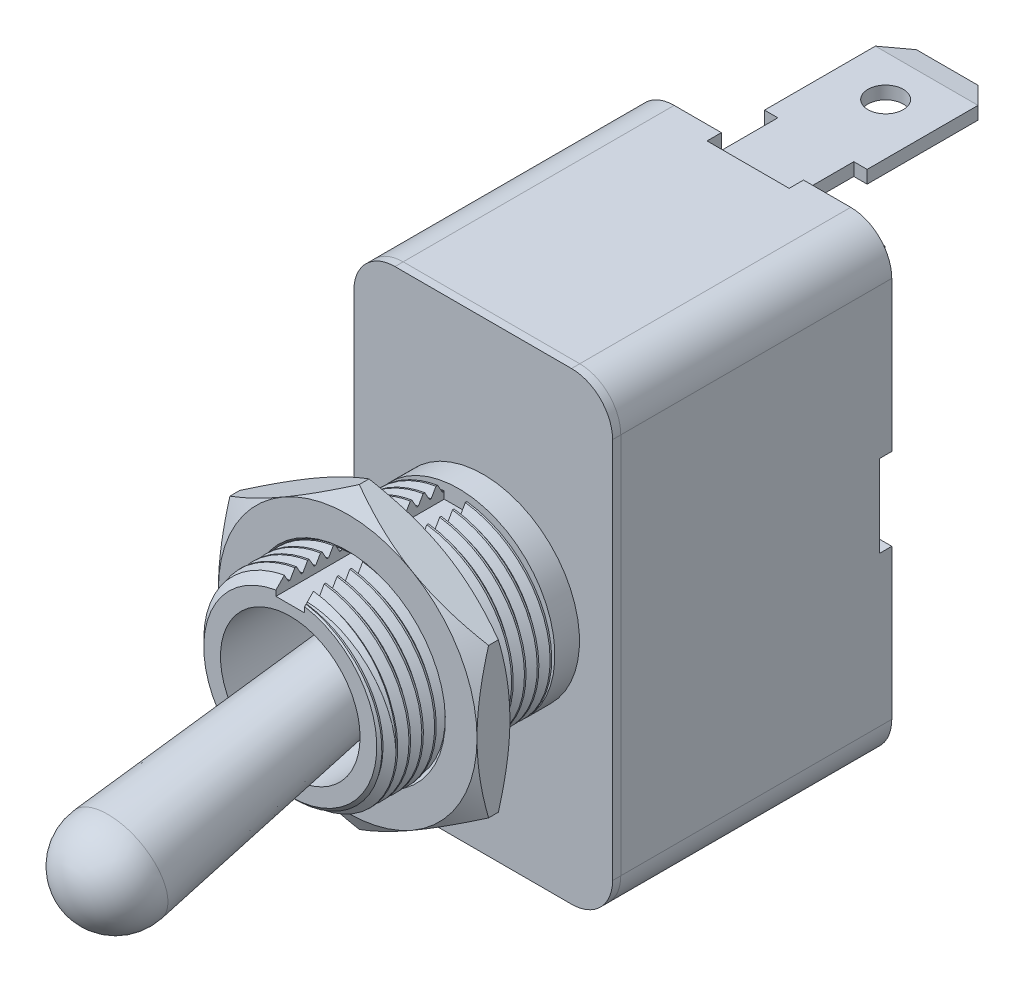
from build123d import *
from OCP.BRepFilletAPI import BRepFilletAPI_MakeChamfer

# Parameters (mm, degrees)
SKETCH4_R             = 5.953125
BOSS_EXTRUDE1_DEPTH   = 10.414
CUT_SWEEP1_PITCH      = 0.79375
SKETCH7_OUTSIDE_W     = 38.694
SKETCH7_OUTSIDE_H     = 38.694
SKETCH7_OUTSIDE_R     = 5.351643294
CUT_EXTRUDE1_DEPTH    = 10.414
CUT_EXTRUDE1_DRAFT    = -45
SKETCH8_R             = 5.953125
BOSS_EXTRUDE2_DEPTH   = 1.524
BOSS_EXTRUDE3_DEPTH   = 0.508
SKETCH10_R            = 4.318
CUT_EXTRUDE2_DEPTH    = 11.938
CUT_EXTRUDE3_DEPTH    = 10.414
BOSS_EXTRUDE4_DEPTH   = 16.764
SKETCH14_W            = 8.382
SKETCH14_H            = 5.08
CUT_EXTRUDE4_DEPTH    = 0.889
SKETCH15_W            = 5.08
SKETCH15_H            = 16.002
CUT_EXTRUDE5_DEPTH    = 0.762
SKETCH16_W            = 6.35
SKETCH16_H            = 4.699
BOSS_EXTRUDE5_DEPTH   = 0.79375
SKETCH17_R            = 1.0922
BOSS_EXTRUDE6_DEPTH   = 0.79375
CHAMFER1_SIZE         = 1.27
CHAMFER2_SIZE         = 1.27
CHAMFER2_SIZE2        = 0.1905
SKETCH18_W            = 4.699
SKETCH18_H            = 6.35
BOSS_EXTRUDE7_DEPTH   = 0.79375
SKETCH19_R            = 1.0922
BOSS_EXTRUDE8_DEPTH   = 0.79375
CHAMFER3_SIZE         = 1.27
CHAMFER4_SIZE         = 0.1905
CHAMFER4_SIZE2        = 1.27
BOSS_EXTRUDE9_START   = -5.585
SKETCH20_R            = 5.437569252
BOSS_EXTRUDE9_DEPTH   = 2.032
BODY_MOVE_COPY1_ANGLE = 120
BODY_MOVE_COPY2_ANGLE = 11.5


with BuildPart() as part:
    # Sketch4 → Boss-Extrude1 (new body)
    with BuildSketch(Plane(origin=(0, 11.938, 0), x_dir=(-1, 0, 0), z_dir=(0, 1, 0))):
        with Locations(Location((0, 0, 0), (0, 0, 90))):
            Circle(SKETCH4_R)
    extrude(amount=-BOSS_EXTRUDE1_DEPTH)

    # Cut-Sweep1: arcs per turn and ends read off the stored shape
    # Cut-Sweep1: the profile of Sketch6 screwed along a right-hand helix through 15.12 turns, 8 arcs to a turn; built about Z, then put on its axis
    cut_sweep1_z = Axis((0, 0, 0), (0, 0, 1))
    cut_sweep1_corners = [(5.437569252, 0, -1.190625), (5.437569252, 0, -1.09140625), (5.996087979, 0, -0.768945313), (5.996087979, 0, -1.513085938)]
    with BuildLine(mode=Mode.PRIVATE) as cut_sweep1_profile:
        Line(cut_sweep1_corners[0], cut_sweep1_corners[1])
        Line(cut_sweep1_corners[1], cut_sweep1_corners[2])
        Line(cut_sweep1_corners[2], cut_sweep1_corners[3])
        Line(cut_sweep1_corners[3], cut_sweep1_corners[0])
    cut_sweep1_cap = Face(cut_sweep1_profile.wire())
    cut_sweep1_turn_angles = [0, 22.5, 45, 67.5, 90, 112.5, 135, 157.5, 180, 202.5, 225, 247.5, 270, 292.5, 315, 337.5, 360]
    cut_sweep1_turn_weights = [1, 0.9238795325112867, 1, 0.9238795325112867, 1, 0.9238795325112867, 1, 0.9238795325112867, 1, 0.9238795325112867, 1, 0.9238795325112867, 1, 0.9238795325112867, 1, 0.9238795325112867, 1]
    cut_sweep1_turn_rails = [Edge.make_bspline([Vector(p[0], p[1], 0).rotate(cut_sweep1_z, cut_sweep1_turn_angles[k]) / cut_sweep1_turn_weights[k] + Vector(0, 0, p[2] + CUT_SWEEP1_PITCH * cut_sweep1_turn_angles[k] / 360) for k in range(17)], [0, 0, 0, 1, 1, 2, 2, 3, 3, 4, 4, 5, 5, 6, 6, 7, 7, 8, 8, 8], 2, cut_sweep1_turn_weights) for p in cut_sweep1_corners]
    cut_sweep1_turn_sides = [Face.make_surface_from_curves(cut_sweep1_turn_rails[p[0]], cut_sweep1_turn_rails[p[1]]) for p in [(0, 1), (1, 2), (2, 3), (3, 0)]]
    cut_sweep1_last_angles = [5400, 5421.6, 5443.2]
    cut_sweep1_last_weights = [1, 0.929776485888252, 1]
    cut_sweep1_last_rails = [Edge.make_bspline([Vector(p[0], p[1], 0).rotate(cut_sweep1_z, cut_sweep1_last_angles[k]) / cut_sweep1_last_weights[k] + Vector(0, 0, p[2] + CUT_SWEEP1_PITCH * cut_sweep1_last_angles[k] / 360) for k in range(3)], [0, 0, 0, 1, 1, 1], 2, cut_sweep1_last_weights) for p in cut_sweep1_corners]
    cut_sweep1_last_sides = [Face.make_surface_from_curves(cut_sweep1_last_rails[p[0]], cut_sweep1_last_rails[p[1]]) for p in [(0, 1), (1, 2), (2, 3), (3, 0)]]
    cut_sweep1 = Plane(origin=(0, 11.938, 0), x_dir=(-1, 0, 0), z_dir=(0, -1, 0)) * Solid(Shell([*[p.moved(Location((0, 0, CUT_SWEEP1_PITCH * i))) for i in range(15) for p in cut_sweep1_turn_sides], *cut_sweep1_last_sides, cut_sweep1_cap, cut_sweep1_cap.rotate(cut_sweep1_z, 5443.2).moved(Location((0, 0, CUT_SWEEP1_PITCH * 5443.2 / 360)))]))
    add(cut_sweep1, mode=Mode.SUBTRACT)


with BuildPart() as cut_extrude1_tool:
    # Sketch7 outside → Cut-Extrude1 (with draft: the straight prism first)
    with BuildSketch(Plane(origin=(0, 11.938, 0), x_dir=(1, 0, 0), z_dir=(0, 1, 0))):
        Rectangle(SKETCH7_OUTSIDE_W, SKETCH7_OUTSIDE_H)
        Circle(SKETCH7_OUTSIDE_R, mode=Mode.SUBTRACT)
    extrude(amount=-CUT_EXTRUDE1_DEPTH)
    # Cut-Extrude1: the draft: its side faces are tilted about the plane it starts from
    cut_extrude1_sides = [cut_extrude1_tool.faces().sort_by_distance(p)[0] for p in [
        (0, 6.731, 19.347),
        (19.347, 6.731, 0),
        (0, 6.731, -19.347),
        (-19.347, 6.731, 0),
        (-5.351643294, 6.731, 0),
    ]]
    draft(cut_extrude1_sides, Plane(origin=(0, 11.938, 0), x_dir=(1, 0, 0), z_dir=(0, 1, 0)), CUT_EXTRUDE1_DRAFT)


with BuildPart() as part_1:
    add(part.part)

    # Cut-Extrude1: cut by cut_extrude1_tool
    add(cut_extrude1_tool.part, mode=Mode.SUBTRACT)

    # Sketch8 → Boss-Extrude2 (add)
    with BuildSketch(Plane.XZ.offset(-1.524)):
        with Locations(Location((0, 0, 0), (0, 0, 92.921710335))):
            Circle(SKETCH8_R)
    extrude(amount=BOSS_EXTRUDE2_DEPTH)

    # Sketch9 → Boss-Extrude3 (add)
    with BuildSketch(Plane.XZ):
        with BuildLine():
            Line((11.811, 8.001), (-11.811, 8.001))
            ThreePointArc((-11.811, 8.001), (-13.607051224, 7.257051224), (-14.351, 5.461))
            Line((-14.351, 5.461), (-14.351, -5.461))
            ThreePointArc((-14.351, -5.461), (-13.607051224, -7.257051224), (-11.811, -8.001))
            Line((-11.811, -8.001), (11.811, -8.001))
            ThreePointArc((11.811, -8.001), (13.607051224, -7.257051224), (14.351, -5.461))
            Line((14.351, -5.461), (14.351, 5.461))
            ThreePointArc((14.351, 5.461), (13.607051224, 7.257051224), (11.811, 8.001))
        make_face()
    extrude(amount=BOSS_EXTRUDE3_DEPTH)

    # Sketch10 → Cut-Extrude2 (cut)
    with BuildSketch(Plane(origin=(0, 11.938, 0), x_dir=(1, 0, 0), z_dir=(0, 1, 0))):
        with Locations(Location((0, 0, 0), (0, 0, 270))):
            Circle(SKETCH10_R)
    extrude(amount=-CUT_EXTRUDE2_DEPTH, mode=Mode.SUBTRACT)

    # Sketch11 → Cut-Extrude3 (cut)
    with BuildSketch(Plane(origin=(0, 11.938, 0), x_dir=(1, 0, 0), z_dir=(0, 1, 0))):
        with BuildLine():
            Line((4.937125, 0.889), (4.937125, -0.889))
            Line((4.937125, -0.889), (5.88637208, -0.889))
            ThreePointArc((5.88637208, -0.889), (5.953125, 0), (5.88637208, 0.889))
            Line((5.88637208, 0.889), (4.937125, 0.889))
        make_face()
    extrude(amount=-CUT_EXTRUDE3_DEPTH, mode=Mode.SUBTRACT)


with BuildPart() as body_2:
    # Sketch12 → Revolve1 (revolve)
    with BuildSketch(Plane.XY, mode=Mode.PRIVATE) as revolve1_sk:
        with BuildLine():
            Line((0, 4.826), (-2.214699358, 4.826))
            Line((-2.214699358, 4.826), (-3.044816605, 22.974731047))
            ThreePointArc((-3.044816605, 22.974731047), (-2.203950518, 25.219446773), (0, 26.162))
            Line((0, 26.162), (0, 4.826))
        make_face()
    revolve(revolve1_sk.sketch.rotate(Axis((0, 0, 0), (0, 1, 0)), 270), axis=Axis((0, 0, 0), (0, 1, 0)))


with BuildPart() as body_3:
    # Sketch13 → Boss-Extrude4 (new body)
    with BuildSketch(Plane.XZ.offset(0.508)):
        with BuildLine():
            Line((11.811, 8.001), (-11.811, 8.001))
            ThreePointArc((-11.811, 8.001), (-13.607051224, 7.257051224), (-14.351, 5.461))
            Line((-14.351, 5.461), (-14.351, -5.461))
            ThreePointArc((-14.351, -5.461), (-13.607051224, -7.257051224), (-11.811, -8.001))
            Line((-11.811, -8.001), (11.811, -8.001))
            ThreePointArc((11.811, -8.001), (13.607051224, -7.257051224), (14.351, -5.461))
            Line((14.351, -5.461), (14.351, 5.461))
            ThreePointArc((14.351, 5.461), (13.607051224, 7.257051224), (11.811, 8.001))
        make_face()
    extrude(amount=BOSS_EXTRUDE4_DEPTH)

    # Sketch14 → Cut-Extrude4 (cut)
    with BuildSketch(Plane.XZ.offset(17.272)):
        with Locations((-10.16, 0)):
            Rectangle(SKETCH14_W, SKETCH14_H)
        with Locations((10.16, 0)):
            Rectangle(SKETCH14_W, SKETCH14_H)
    extrude(amount=-CUT_EXTRUDE4_DEPTH, mode=Mode.SUBTRACT)

    # Sketch15 → Cut-Extrude5 (cut)
    with BuildSketch(Plane.XZ.offset(17.272)):
        Rectangle(SKETCH15_W, SKETCH15_H)
    extrude(amount=-CUT_EXTRUDE5_DEPTH, mode=Mode.SUBTRACT)


with BuildPart() as body_4:
    # Sketch16 → Boss-Extrude5 (new body)
    with BuildSketch(Plane.XZ.offset(16.383)):
        with Locations((10.414, 0)):
            Rectangle(SKETCH16_W, SKETCH16_H)
    extrude(amount=BOSS_EXTRUDE5_DEPTH)

    # Sketch17 → Boss-Extrude6 (add)
    with BuildSketch(Plane.ZY.offset(-13.589)):
        Polygon((-3.175, -28.702), (3.175, -28.702), (3.175, -20.574), (2.3495, -20.574), (2.3495, -16.383), (-2.3495, -16.383), (-2.3495, -20.574), (-3.175, -20.574), align=None)
        with Locations((0, -24.892)):
            Circle(SKETCH17_R, mode=Mode.SUBTRACT)
    extrude(amount=BOSS_EXTRUDE6_DEPTH)

    # Chamfer1
    chamfer1_edges = [body_4.edges().sort_by_distance(p)[0] for p in [
        (13.192125, -28.702, -3.175),
        (13.192125, -28.702, 3.175),
    ]]
    chamfer(chamfer1_edges, length=CHAMFER1_SIZE)

    # Chamfer2: one chamfer whose edges measure the first distance from different faces: ONE call of the kernel's chamfer builder (chamfer() names one face for all edges)
    chamfer2_edges_1 = [body_4.edges().sort_by_distance(p)[0] for p in [
        (13.589, -28.702, 0),
    ]]
    chamfer2_side_1 = [body_4.faces().sort_by_distance(p)[0] for p in [
        (13.589, -22.695100049, 0),
    ]]
    chamfer2_edges_2 = [body_4.edges().sort_by_distance(p)[0] for p in [
        (12.79525, -28.702, 0),
    ]]
    chamfer2_side_2 = [body_4.faces().sort_by_distance(p)[0] for p in [
        (12.79525, -23.04971626, 0),
    ]]
    chamfer2 = BRepFilletAPI_MakeChamfer(body_4.part.solid().wrapped)
    for e in chamfer2_edges_1:
        chamfer2.Add(CHAMFER2_SIZE, CHAMFER2_SIZE2, e.wrapped, chamfer2_side_1[0].wrapped)  # the first distance lies on this face
    for e in chamfer2_edges_2:
        chamfer2.Add(CHAMFER2_SIZE, CHAMFER2_SIZE2, e.wrapped, chamfer2_side_2[0].wrapped)  # the first distance lies on this face
    add(Compound.cast(chamfer2.Shape()), mode=Mode.REPLACE)


with BuildPart() as body_5:
    # Sketch18 → Boss-Extrude7 (new body)
    with BuildSketch(Plane.XZ.offset(16.51)):
        with Locations((0, -1.27)):
            Rectangle(SKETCH18_W, SKETCH18_H)
    extrude(amount=BOSS_EXTRUDE7_DEPTH)

    # Sketch19 → Boss-Extrude8 (add)
    with BuildSketch(Plane.XY.offset(-4.445)):
        Polygon((3.175, -28.702), (-3.175, -28.702), (-3.175, -20.574), (-2.3495, -20.574), (-2.3495, -16.51), (2.3495, -16.51), (2.3495, -20.574), (3.175, -20.574), align=None)
        with Locations((0, -24.892)):
            Circle(SKETCH19_R, mode=Mode.SUBTRACT)
    extrude(amount=BOSS_EXTRUDE8_DEPTH)

    # Chamfer3
    chamfer3_edges = [body_5.edges().sort_by_distance(p)[0] for p in [
        (-3.175, -28.702, -4.048125),
        (3.175, -28.702, -4.048125),
    ]]
    chamfer(chamfer3_edges, length=CHAMFER3_SIZE)

    # Chamfer4
    chamfer4_edges = [body_5.edges().sort_by_distance(p)[0] for p in [
        (0, -28.702, -3.65125),
        (0, -28.702, -4.445),
    ]]
    chamfer4_side = [body_5.faces().sort_by_distance(p)[0] for p in [
        (0, -28.702, -4.048125),
    ]]
    chamfer(chamfer4_edges, length=CHAMFER4_SIZE, length2=CHAMFER4_SIZE2, reference=chamfer4_side[0])


with BuildPart() as body_6:
    # Sketch20 → Boss-Extrude9 (new body)
    with BuildSketch(Plane(origin=(0, 11.938, 0), x_dir=(1, 0, 0), z_dir=(0, 1, 0)).offset(BOSS_EXTRUDE9_START)):
        Polygon((4.619379504, 8.001), (-4.619379504, 8.001), (-9.238759008, 0), (-4.619379504, -8.001), (4.619379504, -8.001), (9.238759008, 0), align=None)
        with Locations(Location((0, 0, 0), (0, 0, 270))):
            Circle(SKETCH20_R, mode=Mode.SUBTRACT)
    extrude(amount=BOSS_EXTRUDE9_DEPTH)

    # Sketch21 → Cut-Revolve1 (revolve, cut)
    with BuildSketch(Plane.XY):
        Polygon((-5.437569252, 8.385), (-5.437569252, 7.783518294), (-6.039050958, 8.385), align=None)
        Polygon((-9.238759008, 8.385), (-8.001, 8.385), (-9.238759008, 7.670379504), align=None)
        Polygon((-5.437569252, 6.954481706), (-5.437569252, 6.353), (-6.039050958, 6.353), align=None)
        Polygon((-9.238759008, 6.353), (-9.238759008, 7.067620496), (-8.001, 6.353), align=None)
    revolve(axis=Axis((0, 8.385, 0), (0, -1, 0)), mode=Mode.SUBTRACT)


with BuildPart() as part_2:
    # Body-Move/Copy1: moved
    add(part_1.part.moved(Location((0, 0, 0))).rotate(Axis((2.677958583, -3.408583833, 0.73062525), (0.5773502691896252, 0.5773502691896272, 0.5773502691896252)), BODY_MOVE_COPY1_ANGLE))


with BuildPart() as body_2_1:
    # Body-Move/Copy1: moved
    add(body_2.part.moved(Location((0, 0, 0))).rotate(Axis((2.677958583, -3.408583833, 0.73062525), (0.5773502691896252, 0.5773502691896272, 0.5773502691896252)), BODY_MOVE_COPY1_ANGLE))


with BuildPart() as body_3_1:
    # Body-Move/Copy1: moved
    add(body_3.part.moved(Location((0, 0, 0))).rotate(Axis((2.677958583, -3.408583833, 0.73062525), (0.5773502691896252, 0.5773502691896272, 0.5773502691896252)), BODY_MOVE_COPY1_ANGLE))


with BuildPart() as body_4_1:
    # Body-Move/Copy1: moved
    add(body_4.part.moved(Location((0, 0, 0))).rotate(Axis((2.677958583, -3.408583833, 0.73062525), (0.5773502691896252, 0.5773502691896272, 0.5773502691896252)), BODY_MOVE_COPY1_ANGLE))


with BuildPart() as body_5_1:
    # Body-Move/Copy1: moved
    add(body_5.part.moved(Location((0, 0, 0))).rotate(Axis((2.677958583, -3.408583833, 0.73062525), (0.5773502691896252, 0.5773502691896272, 0.5773502691896252)), BODY_MOVE_COPY1_ANGLE))


with BuildPart() as body_6_1:
    # Body-Move/Copy1: moved
    add(body_6.part.moved(Location((0, 0, 0))).rotate(Axis((2.677958583, -3.408583833, 0.73062525), (0.5773502691896252, 0.5773502691896272, 0.5773502691896252)), BODY_MOVE_COPY1_ANGLE))


with BuildPart() as body_2_2:
    # Body-Move/Copy2: moved
    add(body_2_1.part.rotate(Axis((0, -6.086542415, 8.831753599), (1, 0, 0)), BODY_MOVE_COPY2_ANGLE))


solid = Compound([part_2.part, body_3_1.part, body_4_1.part, body_5_1.part, body_6_1.part, body_2_2.part])
